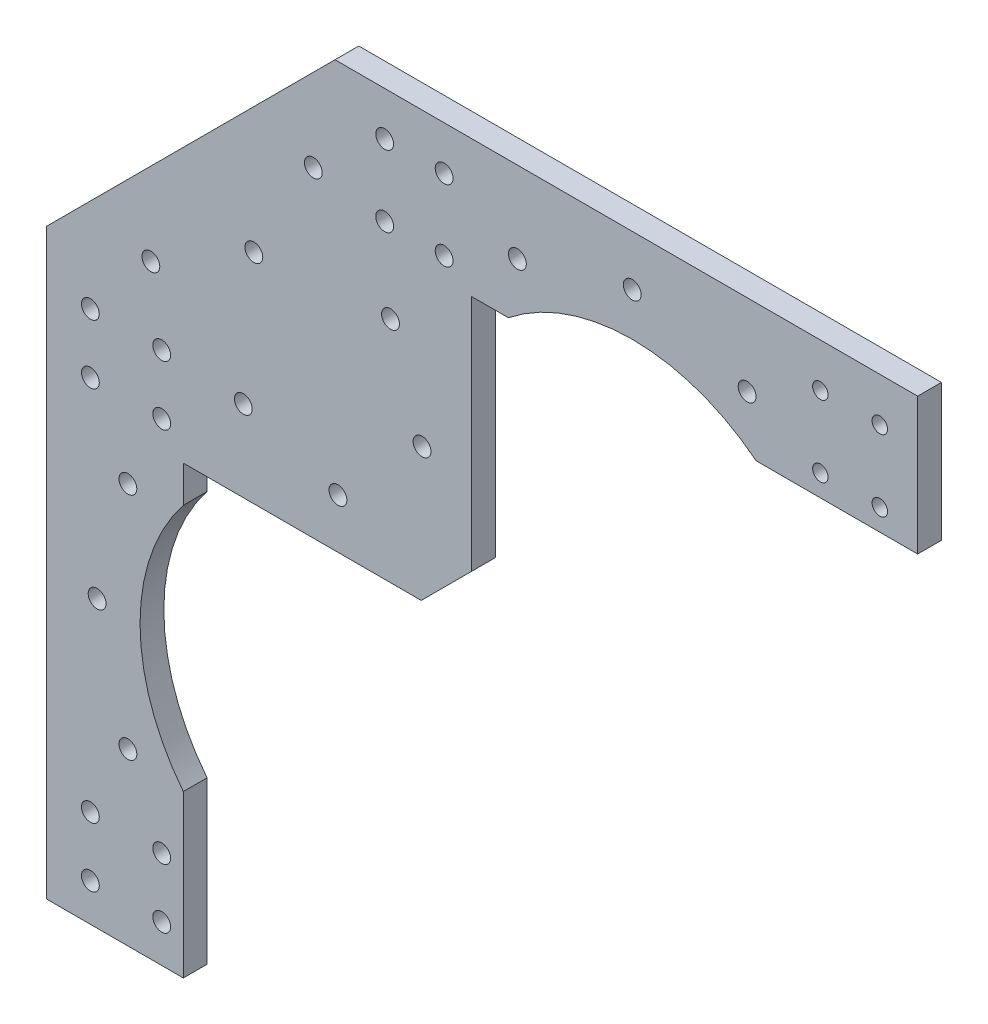
from build123d import *

# Parameters (mm, degrees)
BOSS_EXTRUDE1_DEPTH = 4
SKETCH3_R           = 1.5
SKETCH3_R_2         = 1.3
CUT_EXTRUDE1_DEPTH  = 10
SKETCH4_R           = 1.5
CUT_EXTRUDE2_DEPTH  = 140.357454053


with BuildPart() as part:
    # Sketch1 → Boss-Extrude1 (new body)
    with BuildSketch(Plane.XY):
        with BuildLine():
            Line((-98.5, -48), (-75.5, -48))
            Line((-75.5, -48), (-75.5, -20.842541205))
            ThreePointArc((-75.5, -20.842541205), (-82.779120716, 0), (-75.5, 20.842541205))
            Line((-75.5, 20.842541205), (-75.5, 27))
            Line((-75.5, 27), (-35.485281374, 27))
            Line((-35.485281374, 27), (-27, 35.485281374))
            Line((-27, 35.485281374), (-27, 75.5))
            Line((-27, 75.5), (-20.842541205, 75.5))
            ThreePointArc((-20.842541205, 75.5), (0, 82.779120716), (20.842541205, 75.5))
            Line((20.842541205, 75.5), (48, 75.5))
            Line((48, 75.5), (48, 98.5))
            Line((48, 98.5), (-49.992424049, 98.5))
            Line((-49.992424049, 98.5), (-98.5, 49.992424049))
            Line((-98.5, 49.992424049), (-98.5, -48))
        make_face()
    extrude(amount=BOSS_EXTRUDE1_DEPTH)

    # Sketch3 → Cut-Extrude1 (cut)
    with BuildSketch(Plane.XY.offset(4)):
        with Locations((-91.135133224, -41.635923431)):
            Circle(SKETCH3_R)
        with Locations((-91.135133224, -31.635923431)):
            Circle(SKETCH3_R)
        with Locations((-79.135133224, -31.635923431)):
            Circle(SKETCH3_R)
        with Locations((-79.135133224, -41.635923431)):
            Circle(SKETCH3_R)
        with Locations((-91.135133224, 31.635923431)):
            Circle(SKETCH3_R)
        with Locations((-91.135133224, 41.635923431)):
            Circle(SKETCH3_R)
        with Locations((-79.135133224, 41.635923431)):
            Circle(SKETCH3_R)
        with Locations((-79.135133224, 31.635923431)):
            Circle(SKETCH3_R)
        with Locations((31.635923431, 79.135133224)):
            Circle(SKETCH3_R_2)
        with Locations((31.635923431, 91.135133224)):
            Circle(SKETCH3_R_2)
        with Locations((41.635923431, 91.135133224)):
            Circle(SKETCH3_R_2)
        with Locations((41.635923431, 79.135133224)):
            Circle(SKETCH3_R_2)
        with Locations((-31.635923431, 79.135133224)):
            Circle(SKETCH3_R)
        with Locations((-31.635923431, 91.135133224)):
            Circle(SKETCH3_R)
        with Locations((-41.635923431, 91.135133224)):
            Circle(SKETCH3_R)
        with Locations((-41.635923431, 79.135133224)):
            Circle(SKETCH3_R)
    extrude(amount=-CUT_EXTRUDE1_DEPTH, mode=Mode.SUBTRACT)

    # Sketch4 → Cut-Extrude2 (cut, through all)
    with BuildSketch(Plane.XY.offset(4)):
        with Locations((-90, 0)):
            Circle(SKETCH4_R)
        with Locations((-63.639610307, 63.639610307)):
            Circle(SKETCH4_R)
        with Locations((0, 90)):
            Circle(SKETCH4_R)
        with Locations((-80.960118382, 53.639610307)):
            Circle(SKETCH4_R)
        with Locations((-53.639610307, 80.960118382)):
            Circle(SKETCH4_R)
        with Locations((19.318516526, 84.823619098)):
            Circle(SKETCH4_R)
        with Locations((-19.318516526, 84.823619098)):
            Circle(SKETCH4_R)
        with Locations((-84.823619098, 19.318516526)):
            Circle(SKETCH4_R)
        with Locations((-84.823619098, -19.318516526)):
            Circle(SKETCH4_R)
        with Locations((-40.658639918, 65.40737726)):
            Circle(SKETCH4_R)
        with Locations((-65.40737726, 40.658639918)):
            Circle(SKETCH4_R)
        with Locations((-49.497474683, 35.355339059)):
            Circle(SKETCH4_R)
        with Locations((-35.355339059, 49.497474683)):
            Circle(SKETCH4_R)
    extrude(amount=-CUT_EXTRUDE2_DEPTH, mode=Mode.SUBTRACT)


solid = part.part
